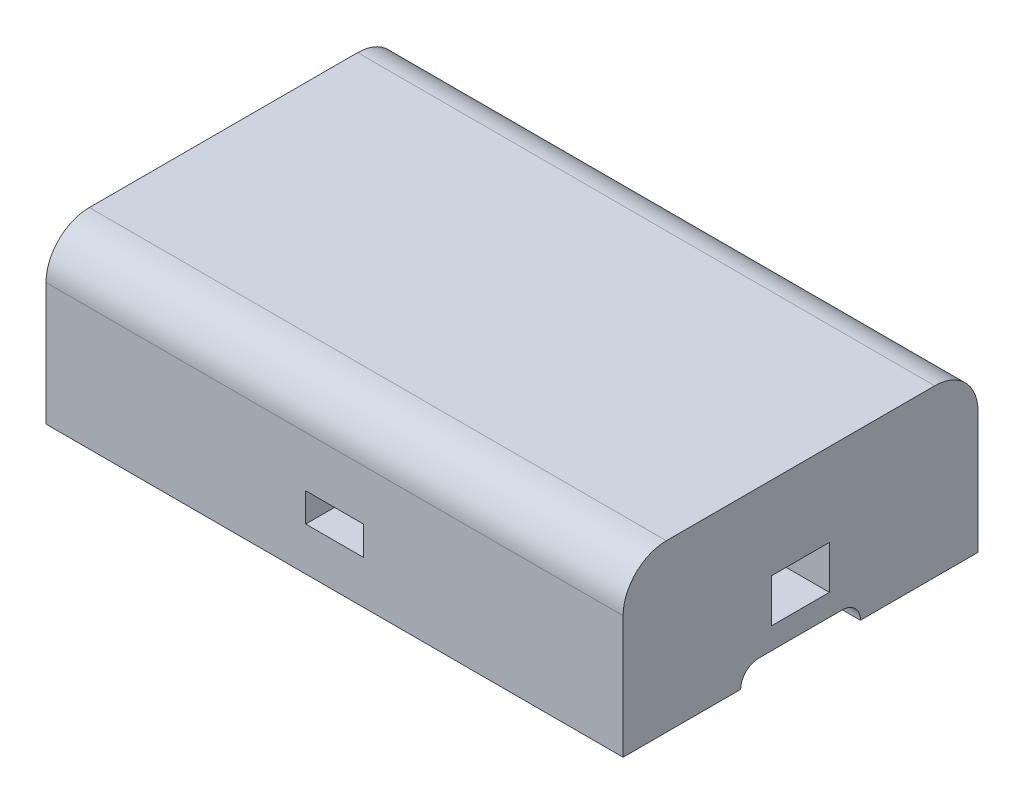
from build123d import *

# Parameters (mm, degrees)
SKETCH1_W            = 40
SKETCH1_H            = 24.6
SKETCH1_W_2          = 34
SKETCH1_H_2          = 18.6
BOSS_EXTRUDE1_DEPTH  = 14
CUT_EXTRUDE1_DEPTH   = 10
SKETCH5_W            = 4
SKETCH5_H            = 3
CUT_EXTRUDE2_DEPTH   = 10
BOSS_EXTRUDE2_DEPTH  = 40
BOSS_EXTRUDE3_DEPTH  = 40
SKETCH8_W            = 4
SKETCH8_H            = 12
BOSS_EXTRUDE4_DEPTH  = 1
FILLET4_R            = 21
SKETCH10_W           = 4
SKETCH10_H           = 2
BOSS_EXTRUDE6_DEPTH  = 1
SKETCH13_W           = 2
SKETCH13_H           = 3
BOSS_EXTRUDE7_DEPTH  = 1
SKETCH14_W           = 2
SKETCH14_H           = 1.5
BOSS_EXTRUDE9_DEPTH  = 1
SKETCH14_4_W         = 2
SKETCH14_4_H         = 1.5
BOSS_EXTRUDE10_DEPTH = 1
CUT_EXTRUDE5_DEPTH   = 28
CUT_EXTRUDE6_DEPTH   = 28
FILLET7_R            = 0.25
SKETCH18_W           = 34
SKETCH18_H           = 18.6
BOSS_EXTRUDE11_DEPTH = 1.25
CUT_EXTRUDE7_DEPTH   = 5.25
SKETCH20_W           = 4
SKETCH20_H           = 2
CUT_EXTRUDE8_DEPTH   = 5.25
SKETCH21_W           = 2
SKETCH21_H           = 1.5
CUT_EXTRUDE9_DEPTH   = 5.25


with BuildPart() as part:
    # Sketch1 → Boss-Extrude1 (new body)
    with BuildSketch(Plane(origin=(0, 0, 0), x_dir=(1, 0, 0), z_dir=(0, 1, 0))):
        Rectangle(SKETCH1_W, SKETCH1_H)
        Rectangle(SKETCH1_W_2, SKETCH1_H_2, mode=Mode.SUBTRACT)
    extrude(amount=BOSS_EXTRUDE1_DEPTH)

    # Sketch3 → Cut-Extrude1 (cut)
    with BuildSketch(Plane(origin=(20, 0, 0), x_dir=(0, 0, -1), z_dir=(1, 0, 0))):
        with BuildLine():
            ThreePointArc((2.9, 4.25), (4.15, 5.5), (2.9, 6.75))
            Line((2.9, 6.75), (-2.9, 6.75))
            ThreePointArc((-2.9, 6.75), (-4.15, 5.5), (-2.9, 4.25))
            Line((-2.9, 4.25), (2.9, 4.25))
        make_face()
    extrude(amount=-CUT_EXTRUDE1_DEPTH, mode=Mode.SUBTRACT)


with BuildPart() as body_2:
    # Split1: the piece on the far side of the plane
    add(part.part)
    split(bisect_by=Plane(origin=(0, 5.5, 0), x_dir=(0, 0, -1), z_dir=(0, -1, 0)), keep=Keep.BOTTOM)

    # Sketch5 → Cut-Extrude2 (cut)
    with BuildSketch(Plane(origin=(20, 0, 0), x_dir=(0, 0, -1), z_dir=(1, 0, 0))):
        with Locations((0, 9.75)):
            Rectangle(SKETCH5_W, SKETCH5_H)
    extrude(amount=-CUT_EXTRUDE2_DEPTH, mode=Mode.SUBTRACT)

    # Sketch6 → Boss-Extrude2 (add)
    with BuildSketch(Plane(origin=(20, 0, 0), x_dir=(0, 0, -1), z_dir=(1, 0, 0))):
        with BuildLine():
            Line((-9.3, 17), (9.3, 17))
            ThreePointArc((9.3, 17), (11.421320344, 16.121320344), (12.3, 14))
            Line((12.3, 14), (-12.3, 14))
            ThreePointArc((-12.3, 14), (-11.421320344, 16.121320344), (-9.3, 17))
        make_face()
    extrude(amount=-BOSS_EXTRUDE2_DEPTH)


with BuildPart() as part_1:
    add(part.part)

    # Split1
    split(bisect_by=Plane(origin=(0, 5.5, 0), x_dir=(0, 0, -1), z_dir=(0, -1, 0)), keep=Keep.TOP)

    # Sketch7 → Boss-Extrude3 (add)
    with BuildSketch(Plane.ZY.offset(20)):
        with BuildLine():
            Line((-9.3, -3), (9.3, -3))
            ThreePointArc((9.3, -3), (11.421320344, -2.121320344), (12.3, 0))
            Line((12.3, 0), (-12.3, 0))
            ThreePointArc((-12.3, 0), (-11.421320344, -2.121320344), (-9.3, -3))
        make_face()
    extrude(amount=-BOSS_EXTRUDE3_DEPTH)

    # Sketch8 → Boss-Extrude4 (add)
    with BuildSketch(Plane.XY.offset(12.3)):
        with Locations((0, 6.5)):
            Rectangle(SKETCH8_W, SKETCH8_H)
    extrude(amount=BOSS_EXTRUDE4_DEPTH)

    # Fillet4
    # the kernel refuses this fillet: 21 mm, written as the material it takes off along each edge
    with BuildSketch(Plane(origin=(18.007810594, 0.5, 13.3), x_dir=(0, 0, -1), z_dir=(-1, 0, 0))) as fillet4_piece_1:
        with BuildLine():
            CenterArc((21, -6.403124237), FILLET4_R, 162.247209838, 17.752790162)
            Line((0, -6.403124237), (-0.42, -6.403124237))
            Line((-0.42, -6.403124237), (-0.42, 0))
            Line((-0.42, 0), (0, 0.42))
            ThreePointArc((0, 0.42), (0.5, 0.42), (0.6, 0.128062485))
            Line((0.6, 0.128062485), (1, 0))
        make_face()
    extrude(amount=36.015621187, mode=Mode.SUBTRACT)

    # Sketch10 → Boss-Extrude6 (add)
    with BuildSketch(Plane(origin=(0, 0, 12.3), x_dir=(-1, 0, 0), z_dir=(0, 0, -1))):
        with Locations((0, 9.5)):
            Rectangle(SKETCH10_W, SKETCH10_H)
    extrude(amount=BOSS_EXTRUDE6_DEPTH)

    # Sketch13 → Boss-Extrude7 (add)
    with BuildSketch(Plane(origin=(0, 0, -12.3), x_dir=(-1, 0, 0), z_dir=(0, 0, -1))):
        with Locations((-12, 7)):
            Rectangle(SKETCH13_W, SKETCH13_H)
        with Locations((12, 7)):
            Rectangle(SKETCH13_W, SKETCH13_H)
    extrude(amount=-BOSS_EXTRUDE7_DEPTH)

    # Sketch14 → Boss-Extrude9 (add)
    with BuildSketch(Plane.XY.offset(-11.3)):
        with Locations((12, 7.75)):
            Rectangle(SKETCH14_W, SKETCH14_H)
    extrude(amount=BOSS_EXTRUDE9_DEPTH)

    # Sketch14<4> → Boss-Extrude10 (add)
    with BuildSketch(Plane.XY.offset(-11.3)):
        with Locations((-12, 7.75)):
            Rectangle(SKETCH14_4_W, SKETCH14_4_H)
        with Locations((12, 7.75)):
            Rectangle(SKETCH14_4_W, SKETCH14_4_H)
    extrude(amount=BOSS_EXTRUDE10_DEPTH)

    # Sketch15 → Cut-Extrude5 (cut)
    with BuildSketch(Plane(origin=(13, 0, 0), x_dir=(0, 0, -1), z_dir=(1, 0, 0))):
        Polygon((10.3, 7), (11.3, 8.5), (10.3, 8.5), align=None)
    extrude(amount=-CUT_EXTRUDE5_DEPTH, mode=Mode.SUBTRACT)

    # Sketch16 → Cut-Extrude6 (cut)
    with BuildSketch(Plane(origin=(2, 0, 0), x_dir=(0, 0, -1), z_dir=(1, 0, 0))):
        Polygon((-13.3, 12.5), (-12.3, 10.5), (-12.3, 12.5), align=None)
    extrude(amount=-CUT_EXTRUDE6_DEPTH, mode=Mode.SUBTRACT)

    # Fillet7
    fillet7_edges = [part_1.edges().sort_by_distance(p)[0] for p in [
        (0, 12.5, 13.3),
    ]]
    fillet(fillet7_edges, radius=FILLET7_R)

    # Sketch18 → Boss-Extrude11 (add)
    with BuildSketch(Plane(origin=(0, 0, 0), x_dir=(1, 0, 0), z_dir=(0, 1, 0))):
        Rectangle(SKETCH18_W, SKETCH18_H)
    extrude(amount=BOSS_EXTRUDE11_DEPTH)

    # Sketch19 → Cut-Extrude7 (cut)
    with BuildSketch(Plane.ZY.offset(2)):
        Polygon((12.3, 10.5), (11.3, 8.5), (11.3, 10.5), align=None)
    extrude(amount=-CUT_EXTRUDE7_DEPTH, mode=Mode.SUBTRACT)


with BuildPart() as body_2_1:
    add(body_2.part)

    # Combine3: cut part
    add(part_1.part, mode=Mode.SUBTRACT)

    # Sketch20 → Cut-Extrude8 (cut)
    with BuildSketch(Plane.XY.offset(12.3)):
        with Locations((0, 9.5)):
            Rectangle(SKETCH20_W, SKETCH20_H)
    extrude(amount=-CUT_EXTRUDE8_DEPTH, mode=Mode.SUBTRACT)

    # Sketch21 → Cut-Extrude9 (cut)
    with BuildSketch(Plane(origin=(0, 0, -12.3), x_dir=(-1, 0, 0), z_dir=(0, 0, -1))):
        with Locations((-12, 7.75)):
            Rectangle(SKETCH21_W, SKETCH21_H)
        with Locations((12, 7.75)):
            Rectangle(SKETCH21_W, SKETCH21_H)
    extrude(amount=-CUT_EXTRUDE9_DEPTH, mode=Mode.SUBTRACT)


solid = body_2_1.part
